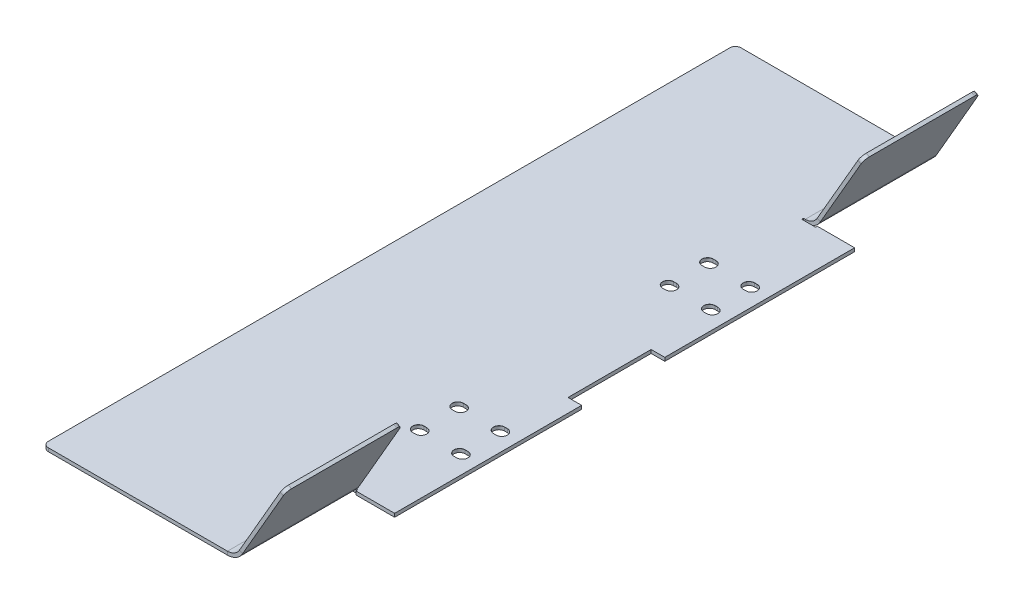
from build123d import *

# Parameters (mm, degrees)
SKETCH1_W                 = 250
SKETCH1_H                 = 1.25
BASE_FLANGE1_DEPTH        = 85
SKETCH9_W                 = 5
SKETCH9_H                 = 30
CUT_EXTRUDE1_DEPTH        = 152.167332781
SKETCH11_W                = 14
SKETCH11_H                = 42
CUT_EXTRUDE2_DEPTH        = 152.167332781
F_4_0MM_START             = -2
F_4_0MM_DOWEL_SLOT2_DEPTH = 3
EDGE_FLANGE1_START        = -125
EDGE_FLANGE1_DEPTH        = 42.625
EDGE_FLANGE1_START_2      = 82.375
EDGE_FLANGE1_2_DEPTH      = 42.625
EDGE_FLANGE1_START_3      = -83
EDGE_FLANGE1_3_DEPTH      = 0.625
EDGE_FLANGE1_4_DEPTH      = 0.625
EDGE_FLANGE1_5_DEPTH      = 42
EDGE_FLANGE1_START_4      = 83
EDGE_FLANGE1_6_DEPTH      = 42
FILLET4_R                 = 2


with BuildPart() as part:
    # Base-Flange1: sheet metal written as solids
    # Sketch1 → Base-Flange1 (new body)
    with BuildSketch(Plane(origin=(0, 0, 0), x_dir=(0, 0, -1), z_dir=(1, 0, 0))):
        with Locations((0, -0.625)):
            Rectangle(SKETCH1_W, SKETCH1_H)
    extrude(amount=BASE_FLANGE1_DEPTH)

    # Sketch9 → Cut-Extrude1 (cut, through all)
    with BuildSketch(Plane(origin=(0, 0, 0), x_dir=(1, 0, 0), z_dir=(0, 1, 0))):
        with Locations((82.583163083, -0.5)):
            Rectangle(SKETCH9_W, SKETCH9_H)
    extrude(amount=-CUT_EXTRUDE1_DEPTH, mode=Mode.SUBTRACT)

    # Sketch11 → Cut-Extrude2 (cut, through all)
    with BuildSketch(Plane(origin=(0, 0, 0), x_dir=(1, 0, 0), z_dir=(0, 1, 0))):
        with Locations((78.529735544, 104)):
            Rectangle(SKETCH11_W, SKETCH11_H)
        with Locations((78, -104)):
            Rectangle(SKETCH11_W, SKETCH11_H)
    extrude(amount=-CUT_EXTRUDE2_DEPTH, mode=Mode.SUBTRACT)

    # Ø4.0mm Dowel Slot2: read off the stored shape, not the designer's step
    # Ø4.0mm Dowel Slot2 outline → Ø4.0mm Dowel Slot2 (cut)
    with BuildSketch(Plane(origin=(0, 0, 0), x_dir=(1, 0, 0), z_dir=(0, 1, 0)).offset(F_4_0MM_START)):
        with BuildLine():
            Line((78.880880592, -50.442183635), (77.880880592, -50.442183635))
            ThreePointArc((77.880880592, -50.442183635), (75.880880592, -52.442183635), (77.880880592, -54.442183635))
            Line((77.880880592, -54.442183635), (78.880880592, -54.442183635))
            ThreePointArc((78.880880592, -54.442183635), (80.880880592, -52.442183635), (78.880880592, -50.442183635))
        make_face()
        with BuildLine():
            ThreePointArc((62.98964279, -50.442183635), (60.98964279, -52.442183635), (62.98964279, -54.442183635))
            Line((62.98964279, -54.442183635), (63.98964279, -54.442183635))
            ThreePointArc((63.98964279, -54.442183635), (65.98964279, -52.442183635), (63.98964279, -50.442183635))
            Line((63.98964279, -50.442183635), (62.98964279, -50.442183635))
        make_face()
        with BuildLine():
            Line((63.98964279, -36.205527502), (62.98964279, -36.205527502))
            ThreePointArc((62.98964279, -36.205527502), (60.98964279, -38.205527502), (62.98964279, -40.205527502))
            Line((62.98964279, -40.205527502), (63.98964279, -40.205527502))
            ThreePointArc((63.98964279, -40.205527502), (65.98964279, -38.205527502), (63.98964279, -36.205527502))
        make_face()
        with BuildLine():
            ThreePointArc((78.880880592, -40.205527502), (80.880880592, -38.205527502), (78.880880592, -36.205527502))
            Line((78.880880592, -36.205527502), (77.880880592, -36.205527502))
            ThreePointArc((77.880880592, -36.205527502), (75.880880592, -38.205527502), (77.880880592, -40.205527502))
            Line((77.880880592, -40.205527502), (78.880880592, -40.205527502))
        make_face()
        with BuildLine():
            ThreePointArc((63.98964279, 35.733431204), (65.98964279, 37.733431204), (63.98964279, 39.733431204))
            Line((63.98964279, 39.733431204), (62.98964279, 39.733431204))
            ThreePointArc((62.98964279, 39.733431204), (60.98964279, 37.733431204), (62.98964279, 35.733431204))
            Line((62.98964279, 35.733431204), (63.98964279, 35.733431204))
        make_face()
        with BuildLine():
            ThreePointArc((78.880880592, 35.733431204), (80.880880592, 37.733431204), (78.880880592, 39.733431204))
            Line((78.880880592, 39.733431204), (77.880880592, 39.733431204))
            ThreePointArc((77.880880592, 39.733431204), (75.880880592, 37.733431204), (77.880880592, 35.733431204))
            Line((77.880880592, 35.733431204), (78.880880592, 35.733431204))
        make_face()
        with BuildLine():
            Line((62.98964279, 49.956082819), (63.98964279, 49.956082819))
            ThreePointArc((63.98964279, 49.956082819), (65.98964279, 51.956082819), (63.98964279, 53.956082819))
            Line((63.98964279, 53.956082819), (62.98964279, 53.956082819))
            ThreePointArc((62.98964279, 53.956082819), (60.98964279, 51.956082819), (62.98964279, 49.956082819))
        make_face()
        with BuildLine():
            ThreePointArc((78.880880592, 49.956082819), (80.880880592, 51.956082819), (78.880880592, 53.956082819))
            Line((78.880880592, 53.956082819), (77.880880592, 53.956082819))
            ThreePointArc((77.880880592, 53.956082819), (75.880880592, 51.956082819), (77.880880592, 49.956082819))
            Line((77.880880592, 49.956082819), (78.880880592, 49.956082819))
        make_face()
    extrude(amount=F_4_0MM_DOWEL_SLOT2_DEPTH, mode=Mode.SUBTRACT)

    # 4.0mm Dowel Slot2 2: loft between two sections, ruled curve by curve
    f_4_0mm_dowel_slot2_2_from = [
        Edge.make_three_point_arc((78.880880592, -0.025, 54.442183635), (80.295094155, -0.025, 53.856397197), (80.880880592, -0.025, 52.442183635)),
        Edge.make_three_point_arc((80.880880592, -0.025, 52.442183635), (80.295094155, -0.025, 51.027970072), (78.880880592, -0.025, 50.442183635)),
        Edge.make_three_point_arc((77.880880592, -0.025, 50.442183635), (76.46666703, -0.025, 51.027970072), (75.880880592, -0.025, 52.442183635)),
        Edge.make_three_point_arc((75.880880592, -0.025, 52.442183635), (76.46666703, -0.025, 53.856397197), (77.880880592, -0.025, 54.442183635)),
        Edge.make_line((78.880880592, -0.025, 50.442183635), (77.880880592, -0.025, 50.442183635)),
        Edge.make_line((78.880880592, -0.025, 54.442183635), (77.880880592, -0.025, 54.442183635)),
    ]
    f_4_0mm_dowel_slot2_2_to = [
        Edge.make_three_point_arc((78.880880592, 0, 54.467183635), (80.312771824, 0, 53.874074866), (80.905880592, 0, 52.442183635)),
        Edge.make_three_point_arc((80.905880592, 0, 52.442183635), (80.312771824, 0, 51.010292403), (78.880880592, 0, 50.417183635)),
        Edge.make_three_point_arc((77.880880592, 0, 50.417183635), (76.44898936, 0, 51.010292403), (75.855880592, 0, 52.442183635)),
        Edge.make_three_point_arc((75.855880592, 0, 52.442183635), (76.44898936, 0, 53.874074866), (77.880880592, 0, 54.467183635)),
        Edge.make_line((78.880880592, 0, 50.417183635), (77.880880592, 0, 50.417183635)),
        Edge.make_line((78.880880592, 0, 54.467183635), (77.880880592, 0, 54.467183635)),
    ]
    f_4_0mm_dowel_slot2_2 = Solid(Shell([*[Face.make_surface_from_curves(f_4_0mm_dowel_slot2_2_from[k], f_4_0mm_dowel_slot2_2_to[k]) for k in range(6)], Face(Wire(f_4_0mm_dowel_slot2_2_from)), Face(Wire(f_4_0mm_dowel_slot2_2_to))]))
    add(f_4_0mm_dowel_slot2_2, mode=Mode.SUBTRACT)

    # 4.0mm Dowel Slot2 3: loft between two sections, ruled curve by curve
    f_4_0mm_dowel_slot2_3_from = [
        Edge.make_three_point_arc((63.98964279, -0.025, 54.442183635), (65.403856353, -0.025, 53.856397197), (65.98964279, -0.025, 52.442183635)),
        Edge.make_three_point_arc((65.98964279, -0.025, 52.442183635), (65.403856353, -0.025, 51.027970072), (63.98964279, -0.025, 50.442183635)),
        Edge.make_three_point_arc((62.98964279, -0.025, 50.442183635), (61.575429228, -0.025, 51.027970072), (60.98964279, -0.025, 52.442183635)),
        Edge.make_three_point_arc((60.98964279, -0.025, 52.442183635), (61.575429228, -0.025, 53.856397197), (62.98964279, -0.025, 54.442183635)),
        Edge.make_line((63.98964279, -0.025, 50.442183635), (62.98964279, -0.025, 50.442183635)),
        Edge.make_line((63.98964279, -0.025, 54.442183635), (62.98964279, -0.025, 54.442183635)),
    ]
    f_4_0mm_dowel_slot2_3_to = [
        Edge.make_three_point_arc((63.98964279, 0, 54.467183635), (65.421534022, 0, 53.874074866), (66.01464279, 0, 52.442183635)),
        Edge.make_three_point_arc((66.01464279, 0, 52.442183635), (65.421534022, 0, 51.010292403), (63.98964279, 0, 50.417183635)),
        Edge.make_three_point_arc((62.98964279, 0, 50.417183635), (61.557751558, 0, 51.010292403), (60.96464279, 0, 52.442183635)),
        Edge.make_three_point_arc((60.96464279, 0, 52.442183635), (61.557751558, 0, 53.874074866), (62.98964279, 0, 54.467183635)),
        Edge.make_line((63.98964279, 0, 50.417183635), (62.98964279, 0, 50.417183635)),
        Edge.make_line((63.98964279, 0, 54.467183635), (62.98964279, 0, 54.467183635)),
    ]
    f_4_0mm_dowel_slot2_3 = Solid(Shell([*[Face.make_surface_from_curves(f_4_0mm_dowel_slot2_3_from[k], f_4_0mm_dowel_slot2_3_to[k]) for k in range(6)], Face(Wire(f_4_0mm_dowel_slot2_3_from)), Face(Wire(f_4_0mm_dowel_slot2_3_to))]))
    add(f_4_0mm_dowel_slot2_3, mode=Mode.SUBTRACT)

    # 4.0mm Dowel Slot2 4: loft between two sections, ruled curve by curve
    f_4_0mm_dowel_slot2_4_from = [
        Edge.make_three_point_arc((63.98964279, -0.025, 40.205527502), (65.403856353, -0.025, 39.619741064), (65.98964279, -0.025, 38.205527502)),
        Edge.make_three_point_arc((65.98964279, -0.025, 38.205527502), (65.403856353, -0.025, 36.791313939), (63.98964279, -0.025, 36.205527502)),
        Edge.make_three_point_arc((62.98964279, -0.025, 36.205527502), (61.575429228, -0.025, 36.791313939), (60.98964279, -0.025, 38.205527502)),
        Edge.make_three_point_arc((60.98964279, -0.025, 38.205527502), (61.575429228, -0.025, 39.619741064), (62.98964279, -0.025, 40.205527502)),
        Edge.make_line((63.98964279, -0.025, 36.205527502), (62.98964279, -0.025, 36.205527502)),
        Edge.make_line((63.98964279, -0.025, 40.205527502), (62.98964279, -0.025, 40.205527502)),
    ]
    f_4_0mm_dowel_slot2_4_to = [
        Edge.make_three_point_arc((63.98964279, 0, 40.230527502), (65.421534022, 0, 39.637418734), (66.01464279, 0, 38.205527502)),
        Edge.make_three_point_arc((66.01464279, 0, 38.205527502), (65.421534022, 0, 36.77363627), (63.98964279, 0, 36.180527502)),
        Edge.make_three_point_arc((62.98964279, 0, 36.180527502), (61.557751558, 0, 36.77363627), (60.96464279, 0, 38.205527502)),
        Edge.make_three_point_arc((60.96464279, 0, 38.205527502), (61.557751558, 0, 39.637418734), (62.98964279, 0, 40.230527502)),
        Edge.make_line((63.98964279, 0, 36.180527502), (62.98964279, 0, 36.180527502)),
        Edge.make_line((63.98964279, 0, 40.230527502), (62.98964279, 0, 40.230527502)),
    ]
    f_4_0mm_dowel_slot2_4 = Solid(Shell([*[Face.make_surface_from_curves(f_4_0mm_dowel_slot2_4_from[k], f_4_0mm_dowel_slot2_4_to[k]) for k in range(6)], Face(Wire(f_4_0mm_dowel_slot2_4_from)), Face(Wire(f_4_0mm_dowel_slot2_4_to))]))
    add(f_4_0mm_dowel_slot2_4, mode=Mode.SUBTRACT)

    # 4.0mm Dowel Slot2 5: loft between two sections, ruled curve by curve
    f_4_0mm_dowel_slot2_5_from = [
        Edge.make_three_point_arc((78.880880592, -0.025, 40.205527502), (80.295094155, -0.025, 39.619741064), (80.880880592, -0.025, 38.205527502)),
        Edge.make_three_point_arc((80.880880592, -0.025, 38.205527502), (80.295094155, -0.025, 36.791313939), (78.880880592, -0.025, 36.205527502)),
        Edge.make_three_point_arc((77.880880592, -0.025, 36.205527502), (76.46666703, -0.025, 36.791313939), (75.880880592, -0.025, 38.205527502)),
        Edge.make_three_point_arc((75.880880592, -0.025, 38.205527502), (76.46666703, -0.025, 39.619741064), (77.880880592, -0.025, 40.205527502)),
        Edge.make_line((78.880880592, -0.025, 36.205527502), (77.880880592, -0.025, 36.205527502)),
        Edge.make_line((78.880880592, -0.025, 40.205527502), (77.880880592, -0.025, 40.205527502)),
    ]
    f_4_0mm_dowel_slot2_5_to = [
        Edge.make_three_point_arc((78.880880592, 0, 40.230527502), (80.312771824, 0, 39.637418734), (80.905880592, 0, 38.205527502)),
        Edge.make_three_point_arc((80.905880592, 0, 38.205527502), (80.312771824, 0, 36.77363627), (78.880880592, 0, 36.180527502)),
        Edge.make_three_point_arc((77.880880592, 0, 36.180527502), (76.44898936, 0, 36.77363627), (75.855880592, 0, 38.205527502)),
        Edge.make_three_point_arc((75.855880592, 0, 38.205527502), (76.44898936, 0, 39.637418734), (77.880880592, 0, 40.230527502)),
        Edge.make_line((78.880880592, 0, 36.180527502), (77.880880592, 0, 36.180527502)),
        Edge.make_line((78.880880592, 0, 40.230527502), (77.880880592, 0, 40.230527502)),
    ]
    f_4_0mm_dowel_slot2_5 = Solid(Shell([*[Face.make_surface_from_curves(f_4_0mm_dowel_slot2_5_from[k], f_4_0mm_dowel_slot2_5_to[k]) for k in range(6)], Face(Wire(f_4_0mm_dowel_slot2_5_from)), Face(Wire(f_4_0mm_dowel_slot2_5_to))]))
    add(f_4_0mm_dowel_slot2_5, mode=Mode.SUBTRACT)

    # 4.0mm Dowel Slot2 6: loft between two sections, ruled curve by curve
    f_4_0mm_dowel_slot2_6_from = [
        Edge.make_three_point_arc((63.98964279, -0.025, -35.733431204), (65.403856353, -0.025, -36.319217642), (65.98964279, -0.025, -37.733431204)),
        Edge.make_three_point_arc((65.98964279, -0.025, -37.733431204), (65.403856353, -0.025, -39.147644767), (63.98964279, -0.025, -39.733431204)),
        Edge.make_three_point_arc((62.98964279, -0.025, -39.733431204), (61.575429228, -0.025, -39.147644767), (60.98964279, -0.025, -37.733431204)),
        Edge.make_three_point_arc((60.98964279, -0.025, -37.733431204), (61.575429228, -0.025, -36.319217642), (62.98964279, -0.025, -35.733431204)),
        Edge.make_line((63.98964279, -0.025, -39.733431204), (62.98964279, -0.025, -39.733431204)),
        Edge.make_line((63.98964279, -0.025, -35.733431204), (62.98964279, -0.025, -35.733431204)),
    ]
    f_4_0mm_dowel_slot2_6_to = [
        Edge.make_three_point_arc((63.98964279, 0, -35.708431204), (65.421534022, 0, -36.301539973), (66.01464279, 0, -37.733431204)),
        Edge.make_three_point_arc((66.01464279, 0, -37.733431204), (65.421534022, 0, -39.165322436), (63.98964279, 0, -39.758431204)),
        Edge.make_three_point_arc((62.98964279, 0, -39.758431204), (61.557751558, 0, -39.165322436), (60.96464279, 0, -37.733431204)),
        Edge.make_three_point_arc((60.96464279, 0, -37.733431204), (61.557751558, 0, -36.301539973), (62.98964279, 0, -35.708431204)),
        Edge.make_line((63.98964279, 0, -39.758431204), (62.98964279, 0, -39.758431204)),
        Edge.make_line((63.98964279, 0, -35.708431204), (62.98964279, 0, -35.708431204)),
    ]
    f_4_0mm_dowel_slot2_6 = Solid(Shell([*[Face.make_surface_from_curves(f_4_0mm_dowel_slot2_6_from[k], f_4_0mm_dowel_slot2_6_to[k]) for k in range(6)], Face(Wire(f_4_0mm_dowel_slot2_6_from)), Face(Wire(f_4_0mm_dowel_slot2_6_to))]))
    add(f_4_0mm_dowel_slot2_6, mode=Mode.SUBTRACT)

    # 4.0mm Dowel Slot2 7: loft between two sections, ruled curve by curve
    f_4_0mm_dowel_slot2_7_from = [
        Edge.make_three_point_arc((78.880880592, -0.025, -35.733431204), (80.295094155, -0.025, -36.319217642), (80.880880592, -0.025, -37.733431204)),
        Edge.make_three_point_arc((80.880880592, -0.025, -37.733431204), (80.295094155, -0.025, -39.147644767), (78.880880592, -0.025, -39.733431204)),
        Edge.make_three_point_arc((77.880880592, -0.025, -39.733431204), (76.46666703, -0.025, -39.147644767), (75.880880592, -0.025, -37.733431204)),
        Edge.make_three_point_arc((75.880880592, -0.025, -37.733431204), (76.46666703, -0.025, -36.319217642), (77.880880592, -0.025, -35.733431204)),
        Edge.make_line((78.880880592, -0.025, -39.733431204), (77.880880592, -0.025, -39.733431204)),
        Edge.make_line((78.880880592, -0.025, -35.733431204), (77.880880592, -0.025, -35.733431204)),
    ]
    f_4_0mm_dowel_slot2_7_to = [
        Edge.make_three_point_arc((78.880880592, 0, -35.708431204), (80.312771824, 0, -36.301539973), (80.905880592, 0, -37.733431204)),
        Edge.make_three_point_arc((80.905880592, 0, -37.733431204), (80.312771824, 0, -39.165322436), (78.880880592, 0, -39.758431204)),
        Edge.make_three_point_arc((77.880880592, 0, -39.758431204), (76.44898936, 0, -39.165322436), (75.855880592, 0, -37.733431204)),
        Edge.make_three_point_arc((75.855880592, 0, -37.733431204), (76.44898936, 0, -36.301539973), (77.880880592, 0, -35.708431204)),
        Edge.make_line((78.880880592, 0, -39.758431204), (77.880880592, 0, -39.758431204)),
        Edge.make_line((78.880880592, 0, -35.708431204), (77.880880592, 0, -35.708431204)),
    ]
    f_4_0mm_dowel_slot2_7 = Solid(Shell([*[Face.make_surface_from_curves(f_4_0mm_dowel_slot2_7_from[k], f_4_0mm_dowel_slot2_7_to[k]) for k in range(6)], Face(Wire(f_4_0mm_dowel_slot2_7_from)), Face(Wire(f_4_0mm_dowel_slot2_7_to))]))
    add(f_4_0mm_dowel_slot2_7, mode=Mode.SUBTRACT)

    # 4.0mm Dowel Slot2 8: loft between two sections, ruled curve by curve
    f_4_0mm_dowel_slot2_8_from = [
        Edge.make_three_point_arc((63.98964279, -0.025, -49.956082819), (65.403856353, -0.025, -50.541869257), (65.98964279, -0.025, -51.956082819)),
        Edge.make_three_point_arc((65.98964279, -0.025, -51.956082819), (65.403856353, -0.025, -53.370296382), (63.98964279, -0.025, -53.956082819)),
        Edge.make_three_point_arc((62.98964279, -0.025, -53.956082819), (61.575429228, -0.025, -53.370296382), (60.98964279, -0.025, -51.956082819)),
        Edge.make_three_point_arc((60.98964279, -0.025, -51.956082819), (61.575429228, -0.025, -50.541869257), (62.98964279, -0.025, -49.956082819)),
        Edge.make_line((63.98964279, -0.025, -53.956082819), (62.98964279, -0.025, -53.956082819)),
        Edge.make_line((63.98964279, -0.025, -49.956082819), (62.98964279, -0.025, -49.956082819)),
    ]
    f_4_0mm_dowel_slot2_8_to = [
        Edge.make_three_point_arc((63.98964279, 0, -49.931082819), (65.421534022, 0, -50.524191588), (66.01464279, 0, -51.956082819)),
        Edge.make_three_point_arc((66.01464279, 0, -51.956082819), (65.421534022, 0, -53.387974051), (63.98964279, 0, -53.981082819)),
        Edge.make_three_point_arc((62.98964279, 0, -53.981082819), (61.557751558, 0, -53.387974051), (60.96464279, 0, -51.956082819)),
        Edge.make_three_point_arc((60.96464279, 0, -51.956082819), (61.557751558, 0, -50.524191588), (62.98964279, 0, -49.931082819)),
        Edge.make_line((63.98964279, 0, -53.981082819), (62.98964279, 0, -53.981082819)),
        Edge.make_line((63.98964279, 0, -49.931082819), (62.98964279, 0, -49.931082819)),
    ]
    f_4_0mm_dowel_slot2_8 = Solid(Shell([*[Face.make_surface_from_curves(f_4_0mm_dowel_slot2_8_from[k], f_4_0mm_dowel_slot2_8_to[k]) for k in range(6)], Face(Wire(f_4_0mm_dowel_slot2_8_from)), Face(Wire(f_4_0mm_dowel_slot2_8_to))]))
    add(f_4_0mm_dowel_slot2_8, mode=Mode.SUBTRACT)

    # 4.0mm Dowel Slot2 9: loft between two sections, ruled curve by curve
    f_4_0mm_dowel_slot2_9_from = [
        Edge.make_three_point_arc((78.880880592, -0.025, -49.956082819), (80.295094155, -0.025, -50.541869257), (80.880880592, -0.025, -51.956082819)),
        Edge.make_three_point_arc((80.880880592, -0.025, -51.956082819), (80.295094155, -0.025, -53.370296382), (78.880880592, -0.025, -53.956082819)),
        Edge.make_three_point_arc((77.880880592, -0.025, -53.956082819), (76.46666703, -0.025, -53.370296382), (75.880880592, -0.025, -51.956082819)),
        Edge.make_three_point_arc((75.880880592, -0.025, -51.956082819), (76.46666703, -0.025, -50.541869257), (77.880880592, -0.025, -49.956082819)),
        Edge.make_line((78.880880592, -0.025, -53.956082819), (77.880880592, -0.025, -53.956082819)),
        Edge.make_line((78.880880592, -0.025, -49.956082819), (77.880880592, -0.025, -49.956082819)),
    ]
    f_4_0mm_dowel_slot2_9_to = [
        Edge.make_three_point_arc((78.880880592, 0, -49.931082819), (80.312771824, 0, -50.524191588), (80.905880592, 0, -51.956082819)),
        Edge.make_three_point_arc((80.905880592, 0, -51.956082819), (80.312771824, 0, -53.387974051), (78.880880592, 0, -53.981082819)),
        Edge.make_three_point_arc((77.880880592, 0, -53.981082819), (76.44898936, 0, -53.387974051), (75.855880592, 0, -51.956082819)),
        Edge.make_three_point_arc((75.855880592, 0, -51.956082819), (76.44898936, 0, -50.524191588), (77.880880592, 0, -49.931082819)),
        Edge.make_line((78.880880592, 0, -53.981082819), (77.880880592, 0, -53.981082819)),
        Edge.make_line((78.880880592, 0, -49.931082819), (77.880880592, 0, -49.931082819)),
    ]
    f_4_0mm_dowel_slot2_9 = Solid(Shell([*[Face.make_surface_from_curves(f_4_0mm_dowel_slot2_9_from[k], f_4_0mm_dowel_slot2_9_to[k]) for k in range(6)], Face(Wire(f_4_0mm_dowel_slot2_9_from)), Face(Wire(f_4_0mm_dowel_slot2_9_to))]))
    add(f_4_0mm_dowel_slot2_9, mode=Mode.SUBTRACT)

    # Edge-Flange1: read off the stored shape, not the designer's step
    # Edge-Flange1 outline → Edge-Flange1 (cut)
    with BuildSketch(Plane.XY.offset(EDGE_FLANGE1_START)):
        with BuildLine():
            ThreePointArc((70.949608526, 0), (69.176032063, -0.929270613), (67.199608525, -1.25))
            Line((67.199608525, -1.25), (71.529735544, -1.25))
            Line((71.529735544, -1.25), (71.529735544, 0))
            Line((71.529735544, 0), (70.949608526, 0))
        make_face()
    extrude(amount=EDGE_FLANGE1_DEPTH, mode=Mode.SUBTRACT)

    # Edge-Flange1 2 outline → Edge-Flange1 2 (cut)
    with BuildSketch(Plane.XY.offset(EDGE_FLANGE1_START_2)):
        with BuildLine():
            ThreePointArc((70.419872982, 0), (68.646296519, -0.929270613), (66.669872981, -1.25))
            Line((66.669872981, -1.25), (71, -1.25))
            Line((71, -1.25), (71, 0))
            Line((71, 0), (70.419872982, 0))
        make_face()
    extrude(amount=EDGE_FLANGE1_2_DEPTH, mode=Mode.SUBTRACT)

    # Edge-Flange1 3 outline → Edge-Flange1 3 (cut)
    with BuildSketch(Plane.XY.offset(EDGE_FLANGE1_START_3)):
        with BuildLine():
            Line((66.574608525, 0), (66.574608525, -1.25))
            Line((66.574608525, -1.25), (67.199608525, -1.25))
            ThreePointArc((67.199608525, -1.25), (69.176032063, -0.929270613), (70.949608526, 0))
            Line((70.949608526, 0), (66.574608525, 0))
        make_face()
    extrude(amount=EDGE_FLANGE1_3_DEPTH, mode=Mode.SUBTRACT)

    # Edge-Flange1 4 outline → Edge-Flange1 4 (cut)
    with BuildSketch(Plane.XY.offset(EDGE_FLANGE1_START_2)):
        with BuildLine():
            Line((66.044872981, -1.25), (66.669872981, -1.25))
            ThreePointArc((66.669872981, -1.25), (68.646296519, -0.929270613), (70.419872982, 0))
            Line((70.419872982, 0), (66.044872981, 0))
            Line((66.044872981, 0), (66.044872981, -1.25))
        make_face()
    extrude(amount=EDGE_FLANGE1_4_DEPTH, mode=Mode.SUBTRACT)

    # Edge-Flange1 5 outline → Edge-Flange1 5 (add)
    with BuildSketch(Plane.XY.offset(EDGE_FLANGE1_START)):
        with BuildLine():
            Line((67.199608525, 0), (70.949608526, 0))
            ThreePointArc((70.949608526, 0), (71.875876824, 0.853312792), (72.612267299, 1.875))
            Line((72.612267299, 1.875), (88.308047708, 29.060889132))
            Line((88.308047708, 29.060889132), (87.225515953, 29.685889132))
            Line((87.225515953, 29.685889132), (71.529735544, 2.5))
            ThreePointArc((71.529735544, 2.5), (69.699608525, 0.669872981), (67.199608525, 0))
        make_face()
    extrude(amount=EDGE_FLANGE1_5_DEPTH)

    # Edge-Flange1 6 outline → Edge-Flange1 6 (add)
    with BuildSketch(Plane.XY.offset(EDGE_FLANGE1_START_4)):
        with BuildLine():
            ThreePointArc((71, 2.5), (69.169872981, 0.669872981), (66.669872981, 0))
            Line((66.669872981, 0), (70.419872982, 0))
            ThreePointArc((70.419872982, 0), (71.34614128, 0.853312792), (72.082531755, 1.875))
            Line((72.082531755, 1.875), (87.778312164, 29.060889132))
            Line((87.778312164, 29.060889132), (86.695780409, 29.685889132))
            Line((86.695780409, 29.685889132), (71, 2.5))
        make_face()
    extrude(amount=EDGE_FLANGE1_6_DEPTH)

    # Fillet4
    fillet4_edges = [part.edges().sort_by_distance(p)[0] for p in [
        (87.766781831, 29.373389132, -83),
        (87.766781831, 29.373389132, -125),
        (87.237046287, 29.373389132, 125),
        (87.237046287, 29.373389132, 83),
        (0, -0.625, 125),
        (0, -0.625, -125),
    ]]
    fillet(fillet4_edges, radius=FILLET4_R)


solid = part.part
